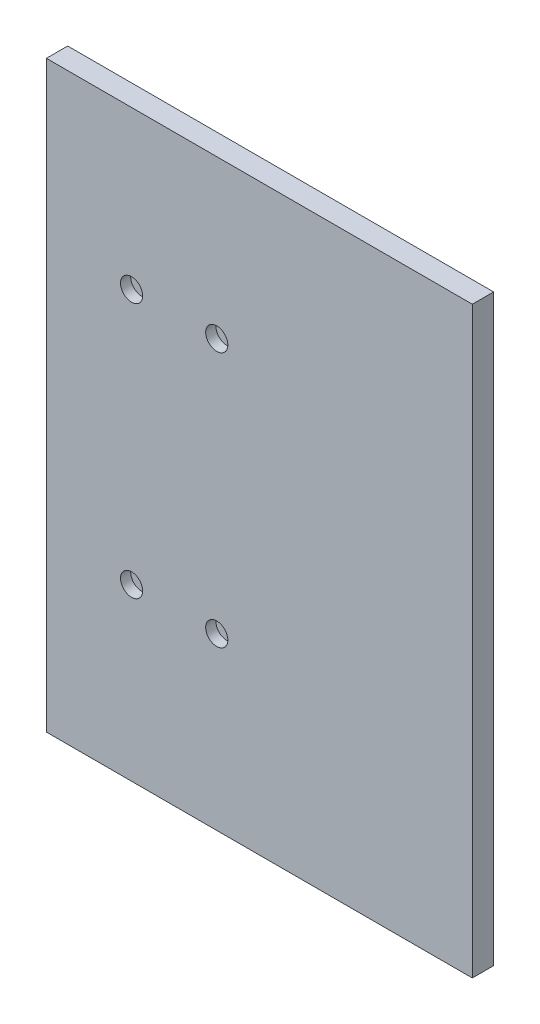
from build123d import *

# Parameters (mm, degrees)
BOSS_EXTRUDE1_DEPTH = 6.35
SKETCH3_R           = 3.302
CUT_EXTRUDE1_DEPTH  = 3.048
SKETCH2_R           = 3.302
CUT_EXTRUDE2_DEPTH  = 3.048


with BuildPart() as part:
    # Sketch1 → Boss-Extrude1 (new body)
    with BuildSketch(Plane.XY):
        Polygon((0, 173.99), (63.5, 173.99), (63.5, 0), (-63.5, 0), (-63.5, 173.99), align=None)
    extrude(amount=BOSS_EXTRUDE1_DEPTH)

    # Sketch3 → Cut-Extrude1 (cut)
    with BuildSketch(Plane.XY.offset(6.35)):
        with Locations((-38.1, 127)):
            Circle(SKETCH3_R)
        with Locations((-12.7, 127)):
            Circle(SKETCH3_R)
        with Locations((-38.1, 50.8)):
            Circle(SKETCH3_R)
        with Locations((-12.7, 50.8)):
            Circle(SKETCH3_R)
    extrude(amount=-CUT_EXTRUDE1_DEPTH, mode=Mode.SUBTRACT)

    # Sketch2 → Cut-Extrude2 (cut)
    with BuildSketch(Plane(origin=(0, 0, 0), x_dir=(-1, 0, 0), z_dir=(0, 0, -1))):
        with Locations((-48.26, 134.62)):
            Circle(SKETCH2_R)
        with Locations((-7.62, 134.62)):
            Circle(SKETCH2_R)
        with Locations((-48.26, 50.8)):
            Circle(SKETCH2_R)
        with Locations((-7.62, 50.8)):
            Circle(SKETCH2_R)
    extrude(amount=-CUT_EXTRUDE2_DEPTH, mode=Mode.SUBTRACT)


solid = part.part
